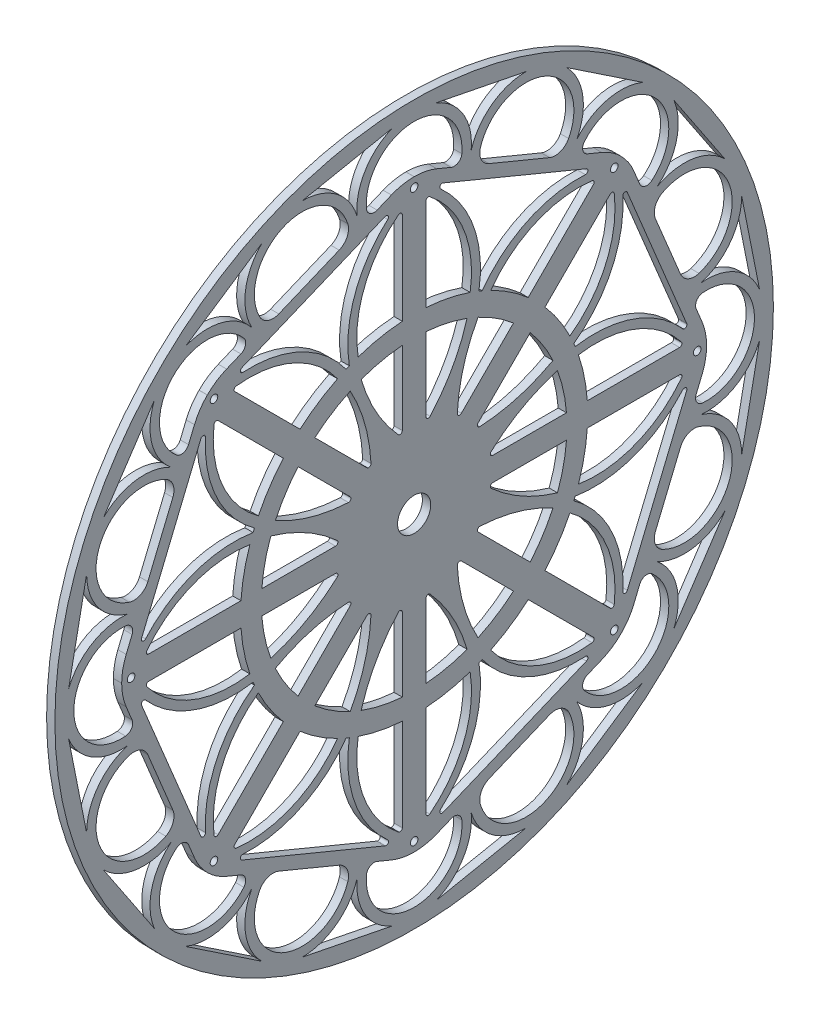
from build123d import *

# Parameters (mm, degrees)
BOSS_EXTRUDE3_DEPTH   = 3.5
CUT_EXTRUDE5_DEPTH    = 3.5
CUT_EXTRUDE6_DEPTH    = 3.5
FILLET3_R             = 1
FILLET4_R             = 25
CIRPATTERN2_OUTLINE_R = 1.5
CIRPATTERN2_DEPTH     = 3.5
BOSS_EXTRUDE5_DEPTH   = 3.5
SKETCH8_R             = 1.6
CUT_EXTRUDE7_DEPTH    = 196.795335456
CIRPATTERN4_COUNT     = 8
SKETCH9_R             = 73.34932166
SKETCH9_R_2           = 64.570140835
BOSS_EXTRUDE6_DEPTH   = 3.5
SKETCH10_R            = 7
CUT_EXTRUDE8_DEPTH    = 10


# Read off the part's stored shape, not the designer's step: CirPattern2
with BuildPart() as part:
    # Sketch1 → Boss-Extrude3 (new body)
    with BuildSketch(Plane.YZ):
        with BuildLine():
            Line((0, 0), (-83.523510552, 83.523510552))
            ThreePointArc((-83.523510552, 83.523510552), (-85.644830895, 83.523510552), (-85.644830895, 85.644830895))
            Line((-85.644830895, 85.644830895), (-87.391798613, 87.391798613))
            Line((-87.391798613, 87.391798613), (-90.927332519, 83.856264707))
            Line((-90.927332519, 83.856264707), (-123.590666839, 5))
            Line((-123.590666839, 5), (-123.590666839, 0))
            Line((-123.590666839, 0), (-121.120081399, 0))
            ThreePointArc((-121.120081399, 0), (-119.620081399, 1.5), (-118.120081399, 0))
            Line((-118.120081399, 0), (0, 0))
        make_face()
    extrude(amount=BOSS_EXTRUDE3_DEPTH)

    # Sketch2 → Cut-Extrude5 (cut)
    with BuildSketch(Plane.YZ.offset(3.5)):
        with BuildLine():
            ThreePointArc((-64.22969944, 26.604812615), (-94.665294208, 24.445038601), (-118.178705837, 5))
            Line((-118.178705837, 5), (-87.100498195, 80.029430384))
            ThreePointArc((-87.100498195, 80.029430384), (-84.223724039, 49.653218916), (-64.22969944, 26.604812615))
        make_face()
        with BuildLine():
            ThreePointArc((-62.69896571, 30.300330745), (-80.685060609, 50.439062402), (-84.272071071, 77.201003259))
            Line((-84.272071071, 77.201003259), (-55.280693042, 48.20962523))
            Line((-55.280693042, 48.20962523), (-62.69896571, 30.300330745))
        make_face()
        with BuildLine():
            Line((-65.760433169, 22.909294485), (-73.178705837, 5))
            Line((-73.178705837, 5), (-114.178705837, 5))
            ThreePointArc((-114.178705837, 5), (-92.718756558, 21.387150435), (-65.760433169, 22.909294485))
        make_face()
    extrude(amount=-CUT_EXTRUDE5_DEPTH, mode=Mode.SUBTRACT)

    # Sketch4 → Cut-Extrude6 (cut)
    with BuildSketch(Plane.YZ.offset(3.5)):
        with BuildLine():
            Line((-51.453858718, 44.382790907), (-25.22623001, 18.155162198))
            ThreePointArc((-25.22623001, 18.155162198), (-42.482972176, 20.525989151), (-58.653593196, 27.001094285))
            Line((-58.653593196, 27.001094285), (-51.453858718, 44.382790907))
        make_face()
        with BuildLine():
            Line((-67.766744836, 5), (-30.675276607, 5))
            ThreePointArc((-30.675276607, 5), (-44.554063831, 15.525931591), (-60.567010358, 22.381696622))
            Line((-60.567010358, 22.381696622), (-67.766744836, 5))
        make_face()
    extrude(amount=-CUT_EXTRUDE6_DEPTH, mode=Mode.SUBTRACT)

    # Fillet3
    fillet3_edges = [part.edges().sort_by_distance(p)[0] for p in [
        (1.75, -114.178705837, 5),
        (1.75, -84.272071071, 77.201003259),
        (1.75, -118.178705837, 5),
        (1.75, -87.100498195, 80.029430384),
        (1.75, -30.675276607, 5),
        (1.75, -25.22623001, 18.155162198),
    ]]
    fillet(fillet3_edges, radius=FILLET3_R)

    # Fillet4
    fillet4_edges = [part.edges().sort_by_distance(p)[0] for p in [
        (1.75, -123.590666839, 5),
        (1.75, -90.927332519, 83.856264707),
    ]]
    fillet(fillet4_edges, radius=FILLET4_R)

    # CirPattern2 outline → CirPattern2 (add)
    with BuildSketch(Plane.YZ):
        with BuildLine():
            ThreePointArc((-85.644830895, 85.644830895), (-83.523510551, 85.644830895), (-83.523510551, 83.523510551))
            Line((-83.523510551, 83.523510551), (0, 0))
            Line((0, 0), (-118.120081399, 0))
            ThreePointArc((-118.120081399, 0), (-119.620081399, -1.5), (-121.120081399, 0))
            Line((-121.120081399, 0), (-123.590666839, 0))
            Line((-123.590666839, 0), (-123.590666839, -0.027190816))
            ThreePointArc((-123.590666839, -0.027190816), (-123.110298849, -4.904448866), (-121.687655152, -9.594276625))
            Line((-121.687655152, -9.594276625), (-92.830344206, -79.261988083))
            ThreePointArc((-92.830344206, -79.261988083), (-90.520096201, -83.584158099), (-87.411025423, -87.372571803))
            Line((-87.411025423, -87.372571803), (-87.372571803, -87.411025423))
            ThreePointArc((-87.372571803, -87.411025423), (-83.584158099, -90.520096201), (-79.261988083, -92.830344206))
            Line((-79.261988083, -92.830344206), (-9.594276625, -121.687655152))
            ThreePointArc((-9.594276625, -121.687655152), (-4.904448866, -123.110298849), (-0.027190816, -123.590666839))
            Line((-0.027190816, -123.590666839), (0.027190816, -123.590666839))
            ThreePointArc((0.027190816, -123.590666839), (4.904448866, -123.110298849), (9.594276625, -121.687655152))
            Line((9.594276625, -121.687655152), (79.261988083, -92.830344206))
            ThreePointArc((79.261988083, -92.830344206), (83.584158099, -90.520096201), (87.372571803, -87.411025423))
            Line((87.372571803, -87.411025423), (87.411025423, -87.372571803))
            ThreePointArc((87.411025423, -87.372571803), (90.520096201, -83.584158099), (92.830344206, -79.261988083))
            Line((92.830344206, -79.261988083), (121.687655152, -9.594276625))
            ThreePointArc((121.687655152, -9.594276625), (123.110298849, -4.904448866), (123.590666839, -0.027190816))
            Line((123.590666839, -0.027190816), (123.590666839, 0.027190816))
            ThreePointArc((123.590666839, 0.027190816), (123.110298849, 4.904448866), (121.687655152, 9.594276625))
            Line((121.687655152, 9.594276625), (92.830344206, 79.261988083))
            ThreePointArc((92.830344206, 79.261988083), (90.520096201, 83.584158099), (87.411025423, 87.372571803))
            Line((87.411025423, 87.372571803), (87.372571803, 87.411025423))
            ThreePointArc((87.372571803, 87.411025423), (83.584158099, 90.520096201), (79.261988083, 92.830344206))
            Line((79.261988083, 92.830344206), (9.594276625, 121.687655152))
            ThreePointArc((9.594276625, 121.687655152), (4.904448866, 123.110298849), (0.027190816, 123.590666839))
            Line((0.027190816, 123.590666839), (-0.027190816, 123.590666839))
            ThreePointArc((-0.027190816, 123.590666839), (-4.904448866, 123.110298849), (-9.594276625, 121.687655152))
            Line((-9.594276625, 121.687655152), (-79.261988083, 92.830344206))
            ThreePointArc((-79.261988083, 92.830344206), (-83.584158099, 90.520096201), (-87.372571803, 87.411025423))
            Line((-87.372571803, 87.411025423), (-87.391798613, 87.391798613))
            Line((-87.391798613, 87.391798613), (-85.644830895, 85.644830895))
        make_face()
        with Locations((-84.584170723, -84.584170723)):
            Circle(CIRPATTERN2_OUTLINE_R, mode=Mode.SUBTRACT)
        with BuildLine():
            ThreePointArc((-72.373701908, -88.165856998), (-46.159210034, -82.565239769), (-26.604812615, -64.22969944))
            ThreePointArc((-26.604812615, -64.22969944), (-25.742950503, -91.02193136), (-11.166739954, -113.518610751))
            ThreePointArc((-11.166739954, -113.518610751), (-10.981502806, -114.797440795), (-12.212184442, -115.191321227))
            Line((-12.212184442, -115.191321227), (-72.817245942, -90.087882806))
            ThreePointArc((-72.817245942, -90.087882806), (-73.408953748, -88.939143951), (-72.373701908, -88.165856998))
        make_face(mode=Mode.SUBTRACT)
        with BuildLine():
            Line((-75.78838816, -82.859455972), (-48.20962523, -55.280693042))
            Line((-48.20962523, -55.280693042), (-30.300330745, -62.69896571))
            ThreePointArc((-30.300330745, -62.69896571), (-49.526195584, -80.252961286), (-75.201713523, -84.559284315))
            ThreePointArc((-75.201713523, -84.559284315), (-76.026564017, -83.892815314), (-75.78838816, -82.859455972))
        make_face(mode=Mode.SUBTRACT)
        with BuildLine():
            ThreePointArc((-6.616801763, -112.96808494), (-21.727104392, -91.767721879), (-22.909294485, -65.760433169))
            Line((-22.909294485, -65.760433169), (-5, -73.178705837))
            Line((-5, -73.178705837), (-5, -112.180966406))
            ThreePointArc((-5, -112.180966406), (-5.562279634, -113.080077568), (-6.616801763, -112.96808494))
        make_face(mode=Mode.SUBTRACT)
        with BuildLine():
            ThreePointArc((-84.559284315, -75.201713523), (-80.252961286, -49.526195584), (-62.69896571, -30.300330745))
            Line((-62.69896571, -30.300330745), (-55.280693042, -48.20962523))
            Line((-55.280693042, -48.20962523), (-82.859455972, -75.78838816))
            ThreePointArc((-82.859455972, -75.78838816), (-83.892815314, -76.026564017), (-84.559284315, -75.201713523))
        make_face(mode=Mode.SUBTRACT)
        with BuildLine():
            ThreePointArc((-113.518610751, -11.166739954), (-91.02193136, -25.742950503), (-64.22969944, -26.604812615))
            ThreePointArc((-64.22969944, -26.604812615), (-82.56523977, -46.159210033), (-88.165856998, -72.373701908))
            ThreePointArc((-88.165856998, -72.373701908), (-88.939143951, -73.408953748), (-90.087882806, -72.817245942))
            Line((-90.087882806, -72.817245942), (-115.191321227, -12.212184442))
            ThreePointArc((-115.191321227, -12.212184442), (-114.797440795, -10.981502806), (-113.518610751, -11.166739954))
        make_face(mode=Mode.SUBTRACT)
        with BuildLine():
            ThreePointArc((-65.760433169, -22.909294485), (-91.767721879, -21.727104392), (-112.96808494, -6.616801763))
            ThreePointArc((-112.96808494, -6.616801763), (-113.080077568, -5.562279634), (-112.180966406, -5))
            Line((-112.180966406, -5), (-73.178705837, -5))
            Line((-73.178705837, -5), (-65.760433169, -22.909294485))
        make_face(mode=Mode.SUBTRACT)
        with BuildLine():
            Line((-27.001094285, -58.653593196), (-44.382790907, -51.453858718))
            Line((-44.382790907, -51.453858718), (-19.942927948, -27.01399576))
            ThreePointArc((-19.942927948, -27.01399576), (-18.830167575, -26.807075647), (-18.237070378, -27.771071133))
            ThreePointArc((-18.237070378, -27.771071133), (-20.862637732, -43.710786353), (-27.001094285, -58.653593196))
        make_face(mode=Mode.SUBTRACT)
        with BuildLine():
            Line((-27.01399576, -19.942927948), (-51.453858718, -44.382790907))
            Line((-51.453858718, -44.382790907), (-58.653593196, -27.001094285))
            ThreePointArc((-58.653593196, -27.001094285), (-43.710786353, -20.862637732), (-27.771071133, -18.237070378))
            ThreePointArc((-27.771071133, -18.237070378), (-26.807075647, -18.830167575), (-27.01399576, -19.942927948))
        make_face(mode=Mode.SUBTRACT)
        with BuildLine():
            Line((-5, -33.203559178), (-5, -67.766744836))
            Line((-5, -67.766744836), (-22.381696622, -60.567010358))
            ThreePointArc((-22.381696622, -60.567010358), (-16.156080828, -45.660306054), (-6.741556586, -32.532668852))
            ThreePointArc((-6.741556586, -32.532668852), (-5.640525791, -32.270404157), (-5, -33.203559178))
        make_face(mode=Mode.SUBTRACT)
        with BuildLine():
            Line((-60.567010358, -22.381696622), (-67.766744836, -5))
            Line((-67.766744836, -5), (-33.203559178, -5))
            ThreePointArc((-33.203559178, -5), (-32.270404157, -5.640525791), (-32.532668852, -6.741556586))
            ThreePointArc((-32.532668852, -6.741556586), (-45.660306054, -16.156080828), (-60.567010358, -22.381696622))
        make_face(mode=Mode.SUBTRACT)
        with Locations((0, -119.620081399)):
            Circle(CIRPATTERN2_OUTLINE_R, mode=Mode.SUBTRACT)
        with BuildLine():
            ThreePointArc((22.909294485, -65.760433169), (21.727104392, -91.767721879), (6.616801763, -112.96808494))
            ThreePointArc((6.616801763, -112.96808494), (5.562279634, -113.080077568), (5, -112.180966406))
            Line((5, -112.180966406), (5, -73.178705837))
            Line((5, -73.178705837), (22.909294485, -65.760433169))
        make_face(mode=Mode.SUBTRACT)
        with BuildLine():
            ThreePointArc((11.166739954, -113.518610751), (25.742950503, -91.02193136), (26.604812615, -64.22969944))
            ThreePointArc((26.604812615, -64.22969944), (46.159210033, -82.56523977), (72.373701908, -88.165856998))
            ThreePointArc((72.373701908, -88.165856998), (73.408953748, -88.939143951), (72.817245942, -90.087882806))
            Line((72.817245942, -90.087882806), (12.212184442, -115.191321227))
            ThreePointArc((12.212184442, -115.191321227), (10.981502806, -114.797440795), (11.166739954, -113.518610751))
        make_face(mode=Mode.SUBTRACT)
        with BuildLine():
            Line((30.300330745, -62.69896571), (48.20962523, -55.280693042))
            Line((48.20962523, -55.280693042), (75.78838816, -82.859455972))
            ThreePointArc((75.78838816, -82.859455972), (76.026564017, -83.892815314), (75.201713523, -84.559284315))
            ThreePointArc((75.201713523, -84.559284315), (49.526195584, -80.252961286), (30.300330745, -62.69896571))
        make_face(mode=Mode.SUBTRACT)
        with Locations((84.584170723, -84.584170723)):
            Circle(CIRPATTERN2_OUTLINE_R, mode=Mode.SUBTRACT)
        with BuildLine():
            Line((22.381696622, -60.567010358), (5, -67.766744836))
            Line((5, -67.766744836), (5, -33.203559178))
            ThreePointArc((5, -33.203559178), (5.640525791, -32.270404157), (6.741556586, -32.532668852))
            ThreePointArc((6.741556586, -32.532668852), (16.156080828, -45.660306054), (22.381696622, -60.567010358))
        make_face(mode=Mode.SUBTRACT)
        with BuildLine():
            Line((19.942927948, -27.01399576), (44.382790907, -51.453858718))
            Line((44.382790907, -51.453858718), (27.001094285, -58.653593196))
            ThreePointArc((27.001094285, -58.653593196), (20.862637732, -43.710786353), (18.237070378, -27.771071133))
            ThreePointArc((18.237070378, -27.771071133), (18.830167575, -26.807075647), (19.942927948, -27.01399576))
        make_face(mode=Mode.SUBTRACT)
        with BuildLine():
            Line((58.653593196, -27.001094285), (51.453858718, -44.382790907))
            Line((51.453858718, -44.382790907), (27.01399576, -19.942927948))
            ThreePointArc((27.01399576, -19.942927948), (26.807075647, -18.830167575), (27.771071133, -18.237070378))
            ThreePointArc((27.771071133, -18.237070378), (43.710786353, -20.862637732), (58.653593196, -27.001094285))
        make_face(mode=Mode.SUBTRACT)
        with BuildLine():
            Line((33.203559178, -5), (67.766744836, -5))
            Line((67.766744836, -5), (60.567010358, -22.381696622))
            ThreePointArc((60.567010358, -22.381696622), (45.660306054, -16.156080828), (32.532668852, -6.741556586))
            ThreePointArc((32.532668852, -6.741556586), (32.270404157, -5.640525791), (33.203559178, -5))
        make_face(mode=Mode.SUBTRACT)
        with BuildLine():
            Line((82.859455972, -75.78838816), (55.280693042, -48.20962523))
            Line((55.280693042, -48.20962523), (62.69896571, -30.300330745))
            ThreePointArc((62.69896571, -30.300330745), (80.252961286, -49.526195584), (84.559284315, -75.201713523))
            ThreePointArc((84.559284315, -75.201713523), (83.892815314, -76.026564017), (82.859455972, -75.78838816))
        make_face(mode=Mode.SUBTRACT)
        with BuildLine():
            ThreePointArc((88.165856998, -72.373701908), (82.565239769, -46.159210034), (64.22969944, -26.604812615))
            ThreePointArc((64.22969944, -26.604812615), (91.02193136, -25.742950503), (113.518610751, -11.166739954))
            ThreePointArc((113.518610751, -11.166739954), (114.797440795, -10.981502806), (115.191321227, -12.212184442))
            Line((115.191321227, -12.212184442), (90.087882806, -72.817245942))
            ThreePointArc((90.087882806, -72.817245942), (88.939143951, -73.408953748), (88.165856998, -72.373701908))
        make_face(mode=Mode.SUBTRACT)
        with BuildLine():
            Line((65.760433169, -22.909294485), (73.178705837, -5))
            Line((73.178705837, -5), (112.180966406, -5))
            ThreePointArc((112.180966406, -5), (113.080077568, -5.562279634), (112.96808494, -6.616801763))
            ThreePointArc((112.96808494, -6.616801763), (91.767721879, -21.727104392), (65.760433169, -22.909294485))
        make_face(mode=Mode.SUBTRACT)
        with BuildLine():
            Line((-19.942927948, 27.01399576), (-44.382790907, 51.453858718))
            Line((-44.382790907, 51.453858718), (-27.001094285, 58.653593196))
            ThreePointArc((-27.001094285, 58.653593196), (-20.862637732, 43.710786353), (-18.237070378, 27.771071133))
            ThreePointArc((-18.237070378, 27.771071133), (-18.830167575, 26.807075647), (-19.942927948, 27.01399576))
        make_face(mode=Mode.SUBTRACT)
        with BuildLine():
            Line((-22.381696622, 60.567010358), (-5, 67.766744836))
            Line((-5, 67.766744836), (-5, 33.203559178))
            ThreePointArc((-5, 33.203559178), (-5.640525791, 32.270404157), (-6.741556586, 32.532668852))
            ThreePointArc((-6.741556586, 32.532668852), (-16.156080828, 45.660306054), (-22.381696622, 60.567010358))
        make_face(mode=Mode.SUBTRACT)
        with BuildLine():
            Line((-30.300330745, 62.69896571), (-48.20962523, 55.280693042))
            Line((-48.20962523, 55.280693042), (-75.78838816, 82.859455972))
            ThreePointArc((-75.78838816, 82.859455972), (-76.026564017, 83.892815314), (-75.201713523, 84.559284315))
            ThreePointArc((-75.201713523, 84.559284315), (-49.526195584, 80.252961286), (-30.300330745, 62.69896571))
        make_face(mode=Mode.SUBTRACT)
        with BuildLine():
            ThreePointArc((-11.166739954, 113.518610751), (-25.742950503, 91.02193136), (-26.604812615, 64.22969944))
            ThreePointArc((-26.604812615, 64.22969944), (-46.159210034, 82.565239769), (-72.373701908, 88.165856998))
            ThreePointArc((-72.373701908, 88.165856998), (-73.408953748, 88.939143951), (-72.817245942, 90.087882806))
            Line((-72.817245942, 90.087882806), (-12.212184442, 115.191321227))
            ThreePointArc((-12.212184442, 115.191321227), (-10.981502806, 114.797440795), (-11.166739954, 113.518610751))
        make_face(mode=Mode.SUBTRACT)
        with BuildLine():
            ThreePointArc((-6.616801763, 112.96808494), (-5.562279634, 113.080077568), (-5, 112.180966406))
            Line((-5, 112.180966406), (-5, 73.178705837))
            Line((-5, 73.178705837), (-22.909294485, 65.760433169))
            ThreePointArc((-22.909294485, 65.760433169), (-21.727104392, 91.767721879), (-6.616801763, 112.96808494))
        make_face(mode=Mode.SUBTRACT)
        with BuildLine():
            Line((60.567010358, 22.381696622), (67.766744836, 5))
            Line((67.766744836, 5), (33.203559178, 5))
            ThreePointArc((33.203559178, 5), (32.270404157, 5.640525791), (32.532668852, 6.741556586))
            ThreePointArc((32.532668852, 6.741556586), (45.660306054, 16.156080828), (60.567010358, 22.381696622))
        make_face(mode=Mode.SUBTRACT)
        with BuildLine():
            Line((5, 33.203559178), (5, 67.766744836))
            Line((5, 67.766744836), (22.381696622, 60.567010358))
            ThreePointArc((22.381696622, 60.567010358), (16.156080828, 45.660306054), (6.741556586, 32.532668852))
            ThreePointArc((6.741556586, 32.532668852), (5.640525791, 32.270404157), (5, 33.203559178))
        make_face(mode=Mode.SUBTRACT)
        with BuildLine():
            Line((27.01399576, 19.942927948), (51.453858718, 44.382790907))
            Line((51.453858718, 44.382790907), (58.653593196, 27.001094285))
            ThreePointArc((58.653593196, 27.001094285), (43.710786353, 20.862637732), (27.771071133, 18.237070378))
            ThreePointArc((27.771071133, 18.237070378), (26.807075647, 18.830167575), (27.01399576, 19.942927948))
        make_face(mode=Mode.SUBTRACT)
        with BuildLine():
            Line((27.001094285, 58.653593196), (44.382790907, 51.453858718))
            Line((44.382790907, 51.453858718), (19.942927948, 27.01399576))
            ThreePointArc((19.942927948, 27.01399576), (18.830167575, 26.807075647), (18.237070378, 27.771071133))
            ThreePointArc((18.237070378, 27.771071133), (20.862637732, 43.710786353), (27.001094285, 58.653593196))
        make_face(mode=Mode.SUBTRACT)
        with BuildLine():
            ThreePointArc((112.96808494, 6.616801763), (113.080077568, 5.562279634), (112.180966406, 5))
            Line((112.180966406, 5), (73.178705837, 5))
            Line((73.178705837, 5), (65.760433169, 22.909294485))
            ThreePointArc((65.760433169, 22.909294485), (91.767721879, 21.727104392), (112.96808494, 6.616801763))
        make_face(mode=Mode.SUBTRACT)
        with Locations((119.620081399, 0)):
            Circle(CIRPATTERN2_OUTLINE_R, mode=Mode.SUBTRACT)
        with BuildLine():
            ThreePointArc((113.518610751, 11.166739954), (91.02193136, 25.742950503), (64.22969944, 26.604812615))
            ThreePointArc((64.22969944, 26.604812615), (82.56523977, 46.159210033), (88.165856998, 72.373701908))
            ThreePointArc((88.165856998, 72.373701908), (88.939143951, 73.408953748), (90.087882806, 72.817245942))
            Line((90.087882806, 72.817245942), (115.191321227, 12.212184442))
            ThreePointArc((115.191321227, 12.212184442), (114.797440795, 10.981502806), (113.518610751, 11.166739954))
        make_face(mode=Mode.SUBTRACT)
        with BuildLine():
            Line((62.69896571, 30.300330745), (55.280693042, 48.20962523))
            Line((55.280693042, 48.20962523), (82.859455972, 75.78838816))
            ThreePointArc((82.859455972, 75.78838816), (83.892815314, 76.026564017), (84.559284315, 75.201713523))
            ThreePointArc((84.559284315, 75.201713523), (80.252961286, 49.526195584), (62.69896571, 30.300330745))
        make_face(mode=Mode.SUBTRACT)
        with BuildLine():
            Line((22.909294485, 65.760433169), (5, 73.178705837))
            Line((5, 73.178705837), (5, 112.180966406))
            ThreePointArc((5, 112.180966406), (5.562279634, 113.080077568), (6.616801763, 112.96808494))
            ThreePointArc((6.616801763, 112.96808494), (21.727104392, 91.767721879), (22.909294485, 65.760433169))
        make_face(mode=Mode.SUBTRACT)
        with BuildLine():
            ThreePointArc((75.201713523, 84.559284315), (76.026564017, 83.892815314), (75.78838816, 82.859455972))
            Line((75.78838816, 82.859455972), (48.20962523, 55.280693042))
            Line((48.20962523, 55.280693042), (30.300330745, 62.69896571))
            ThreePointArc((30.300330745, 62.69896571), (49.526195584, 80.252961286), (75.201713523, 84.559284315))
        make_face(mode=Mode.SUBTRACT)
        with BuildLine():
            ThreePointArc((72.373701908, 88.165856998), (46.159210034, 82.565239769), (26.604812615, 64.22969944))
            ThreePointArc((26.604812615, 64.22969944), (25.742950503, 91.02193136), (11.166739954, 113.518610751))
            ThreePointArc((11.166739954, 113.518610751), (10.981502806, 114.797440795), (12.212184442, 115.191321227))
            Line((12.212184442, 115.191321227), (72.817245942, 90.087882806))
            ThreePointArc((72.817245942, 90.087882806), (73.408953748, 88.939143951), (72.373701908, 88.165856998))
        make_face(mode=Mode.SUBTRACT)
        with Locations((0, 119.620081399)):
            Circle(CIRPATTERN2_OUTLINE_R, mode=Mode.SUBTRACT)
        with Locations((84.584170723, 84.584170723)):
            Circle(CIRPATTERN2_OUTLINE_R, mode=Mode.SUBTRACT)
    extrude(amount=CIRPATTERN2_DEPTH)

    # Sketch7 → Boss-Extrude5 (add)
    with BuildSketch(Plane.YZ.offset(3.5)):
        with BuildLine():
            Line((-147.818676244, 0), (-143.818676244, 0))
            ThreePointArc((-143.818676244, 0), (-137.296284825, 14.877109938), (-121.935316821, 20.160163214))
            ThreePointArc((-121.935316821, 20.160163214), (-119.410563337, 18.604158284), (-119.180378235, 15.647378563))
            Line((-119.180378235, 15.647378563), (-112.548471147, 31.658218597))
            ThreePointArc((-112.548471147, 31.658218597), (-115.751608494, 28.321107938), (-120.36850322, 28.037066564))
            ThreePointArc((-120.36850322, 28.037066564), (-132.871131375, 55.037024663), (-104.93858476, 65.288184976))
            ThreePointArc((-104.93858476, 65.288184976), (-101.874794773, 61.822699826), (-101.969528211, 57.19804611))
            Line((-101.969528211, 57.19804611), (-95.337621123, 73.208886145))
            ThreePointArc((-95.337621123, 73.208886145), (-97.591145561, 71.2808926), (-100.476677509, 71.965901272))
            ThreePointArc((-100.476677509, 71.965901272), (-107.602839353, 86.56342871), (-101.695161233, 101.695161233))
            Line((-101.695161233, 101.695161233), (-104.523588358, 104.523588358))
            Line((-104.523588358, 104.523588358), (-107.352015483, 107.352015483))
            ThreePointArc((-107.352015483, 107.352015483), (-140.262167635, 58.098492122), (-151.818676244, 0))
            Line((-151.818676244, 0), (-147.818676244, 0))
        make_face()
        with BuildLine():
            Line((-109.775560986, 96.663455519), (-131.31467441, 64.427892854))
            ThreePointArc((-131.31467441, 64.427892854), (-117.737874784, 71.261876917), (-102.761887244, 68.663295864))
            ThreePointArc((-102.761887244, 68.663295864), (-110.893725164, 81.504873426), (-109.775560986, 96.663455519))
        make_face(mode=Mode.SUBTRACT)
        with BuildLine():
            Line((-138.410896679, 47.296102897), (-145.974430877, 9.271652886))
            ThreePointArc((-145.974430877, 9.271652886), (-136.046356448, 20.78105474), (-121.215909442, 24.111345194))
            ThreePointArc((-121.215909442, 24.111345194), (-133.643007883, 32.863495699), (-138.410896679, 47.296102897))
        make_face(mode=Mode.SUBTRACT)
    boss_extrude5 = extrude(amount=-BOSS_EXTRUDE5_DEPTH)

    # Sketch8 → Cut-Extrude7 (cut, symmetric)
    with BuildSketch(Plane(origin=(3.5, 0, 0), x_dir=(0, 0, -1), z_dir=(1, 0, 0))):
        with Locations((-84.584170723, -84.584170723)):
            Circle(SKETCH8_R)
    cut_extrude7 = extrude(amount=CUT_EXTRUDE7_DEPTH, both=True, mode=Mode.SUBTRACT)

    # CirPattern4: Boss-Extrude5, Cut-Extrude7 ×8 about axis
    cirpattern4_axis = Axis((0, 0, 0), (1, 0, 0))
    add([boss_extrude5.rotate(cirpattern4_axis, i * 360 / CIRPATTERN4_COUNT) for i in range(1, CIRPATTERN4_COUNT)])
    add([cut_extrude7.rotate(cirpattern4_axis, i * 360 / CIRPATTERN4_COUNT) for i in range(1, CIRPATTERN4_COUNT)], mode=Mode.SUBTRACT)

    # Sketch9 → Boss-Extrude6 (add)
    with BuildSketch(Plane.ZY):
        Circle(SKETCH9_R)
        Circle(SKETCH9_R_2, mode=Mode.SUBTRACT)
    extrude(amount=-BOSS_EXTRUDE6_DEPTH)

    # Sketch10 → Cut-Extrude8 (cut)
    with BuildSketch(Plane.ZY):
        Circle(SKETCH10_R)
    extrude(amount=-CUT_EXTRUDE8_DEPTH, mode=Mode.SUBTRACT)


solid = part.part
